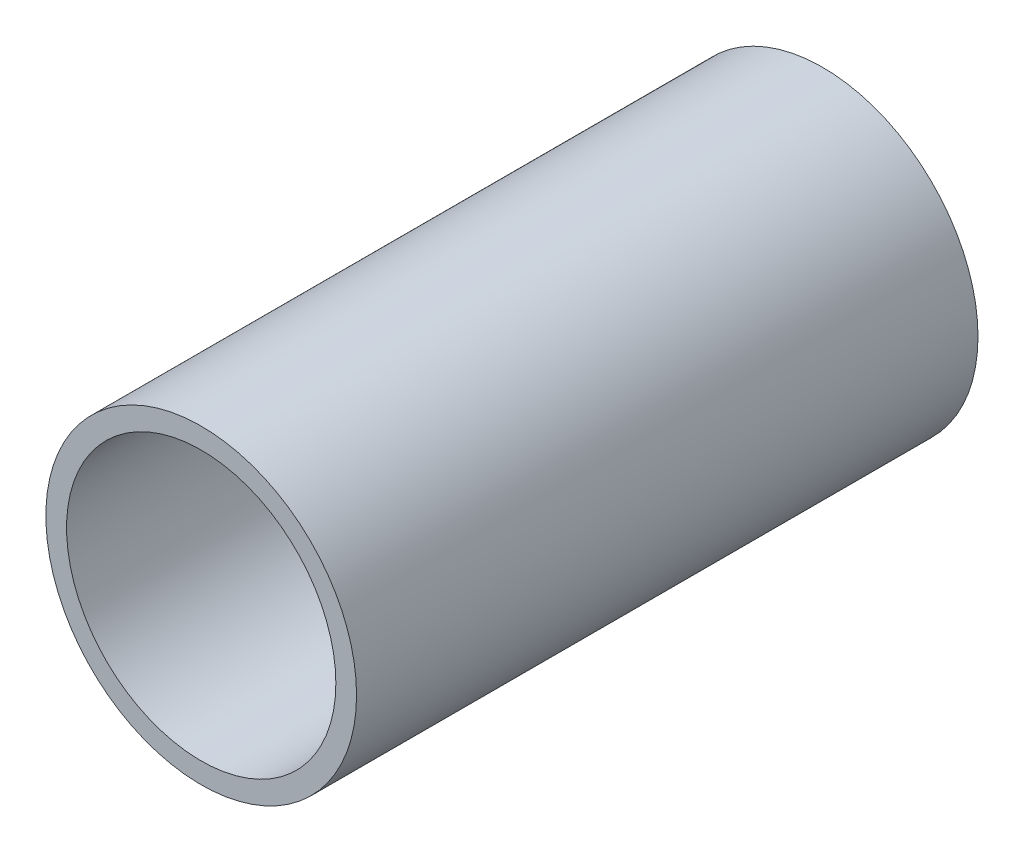
from build123d import *

# Parameters (mm, degrees)
SKETCH1_R           = 7.5
SKETCH1_R_2         = 6.5
BOSS_EXTRUDE1_DEPTH = 30


with BuildPart() as part:
    # Sketch1 → Boss-Extrude1 (new body)
    with BuildSketch(Plane.XY):
        Circle(SKETCH1_R)
        Circle(SKETCH1_R_2, mode=Mode.SUBTRACT)
    extrude(amount=BOSS_EXTRUDE1_DEPTH)


solid = part.part
